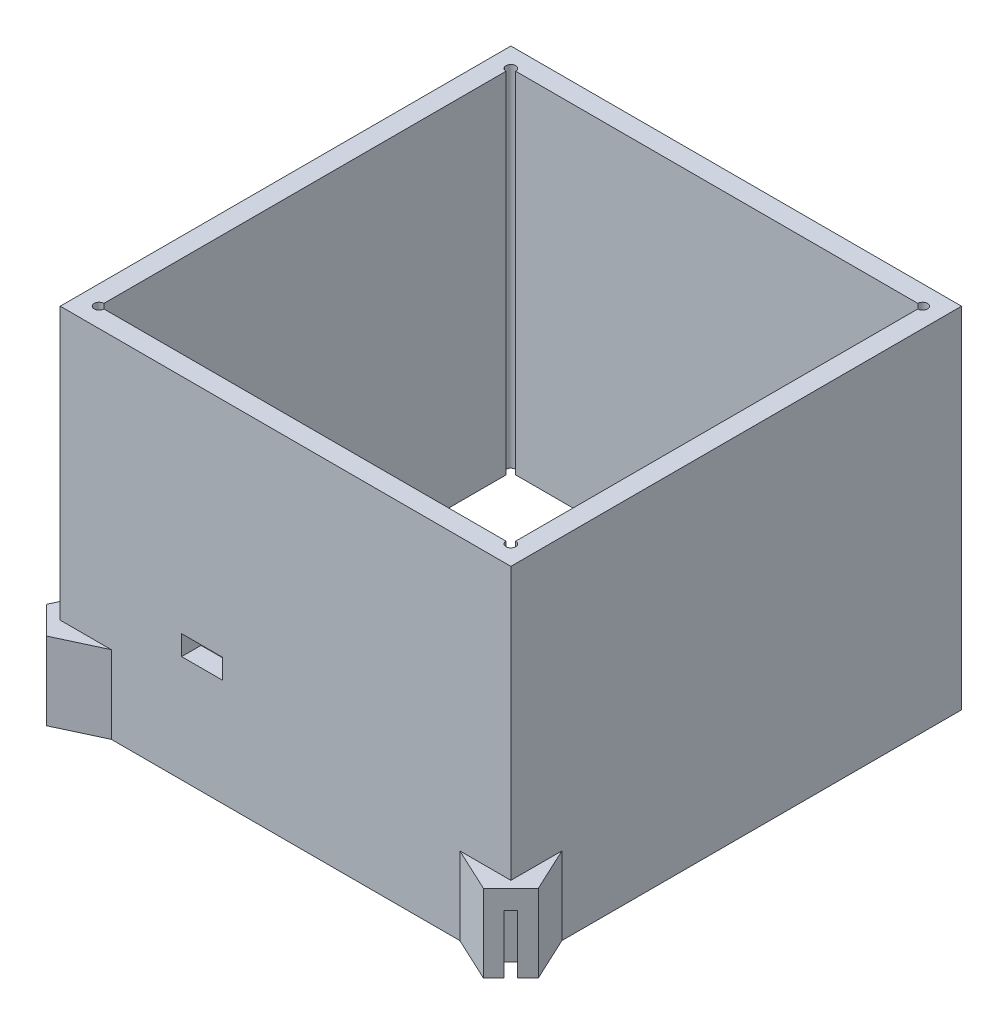
from build123d import *

# Parameters (mm, degrees)
SKETCH2_W           = 232
SKETCH2_H           = 232
SKETCH2_W_2         = 212
SKETCH2_H_2         = 212
BOSS_EXTRUDE1_DEPTH = 180
CUT_EXTRUDE1_REACH  = 317.721
SKETCH3_W           = 21
SKETCH3_H           = 10.25
CUT_EXTRUDE2_REACH  = 317.721
SKETCH4_W           = 21
SKETCH4_H           = 10.25
CUT_EXTRUDE3_REACH  = 245.541
SKETCH5_R           = 2.5
BOSS_EXTRUDE2_DEPTH = 40
BOSS_EXTRUDE3_DEPTH = 40
CUT_EXTRUDE4_DEPTH  = 30


with BuildPart() as part:
    # Sketch2 → Boss-Extrude1 (new body)
    with BuildSketch(Plane(origin=(0, 0, 0), x_dir=(1, 0, 0), z_dir=(0, 1, 0))):
        Rectangle(SKETCH2_W, SKETCH2_H)
        Rectangle(SKETCH2_W_2, SKETCH2_H_2, mode=Mode.SUBTRACT)
    extrude(amount=BOSS_EXTRUDE1_DEPTH)

    # Sketch3 → Cut-Extrude1 (cut, up to next)
    with BuildSketch(Plane.XY.offset(116), mode=Mode.PRIVATE) as cut_extrude1_sk1:
        with Locations((-43, 60.125)):
            Rectangle(SKETCH3_W, SKETCH3_H)
    cut_extrude1_tool1 = extrude(cut_extrude1_sk1.sketch, amount=-CUT_EXTRUDE1_REACH, mode=Mode.PRIVATE) & part.part
    add(cut_extrude1_tool1.solids().sort_by_distance((-43, 60.125, 116))[0], mode=Mode.SUBTRACT)

    # Sketch4 → Cut-Extrude2 (cut, up to next)
    with BuildSketch(Plane(origin=(0, 0, -116), x_dir=(-1, 0, 0), z_dir=(0, 0, -1)), mode=Mode.PRIVATE) as cut_extrude2_sk1:
        with Locations((-43, 60.125)):
            Rectangle(SKETCH4_W, SKETCH4_H)
    cut_extrude2_tool1 = extrude(cut_extrude2_sk1.sketch, amount=-CUT_EXTRUDE2_REACH, mode=Mode.PRIVATE) & part.part
    add(cut_extrude2_tool1.solids().sort_by_distance((43, 60.125, -116))[0], mode=Mode.SUBTRACT)

    # Sketch5 → Cut-Extrude3 (cut, up to next)
    with BuildSketch(Plane(origin=(0, 180, 0), x_dir=(1, 0, 0), z_dir=(0, 1, 0)), mode=Mode.PRIVATE) as cut_extrude3_sk1:
        with Locations((-106, 106)):
            Circle(SKETCH5_R)
    cut_extrude3_tool1 = extrude(cut_extrude3_sk1.sketch, amount=-CUT_EXTRUDE3_REACH, mode=Mode.PRIVATE) & part.part
    # Sketch5 → Cut-Extrude3 (cut, up to next)
    with BuildSketch(Plane(origin=(0, 180, 0), x_dir=(1, 0, 0), z_dir=(0, 1, 0)), mode=Mode.PRIVATE) as cut_extrude3_sk2:
        with Locations((106, 106)):
            Circle(SKETCH5_R)
    cut_extrude3_tool2 = extrude(cut_extrude3_sk2.sketch, amount=-CUT_EXTRUDE3_REACH, mode=Mode.PRIVATE) & part.part
    # Sketch5 → Cut-Extrude3 (cut, up to next)
    with BuildSketch(Plane(origin=(0, 180, 0), x_dir=(1, 0, 0), z_dir=(0, 1, 0)), mode=Mode.PRIVATE) as cut_extrude3_sk3:
        with Locations((106, -106)):
            Circle(SKETCH5_R)
    cut_extrude3_tool3 = extrude(cut_extrude3_sk3.sketch, amount=-CUT_EXTRUDE3_REACH, mode=Mode.PRIVATE) & part.part
    # Sketch5 → Cut-Extrude3 (cut, up to next)
    with BuildSketch(Plane(origin=(0, 180, 0), x_dir=(1, 0, 0), z_dir=(0, 1, 0)), mode=Mode.PRIVATE) as cut_extrude3_sk4:
        with Locations((-106, -106)):
            Circle(SKETCH5_R)
    cut_extrude3_tool4 = extrude(cut_extrude3_sk4.sketch, amount=-CUT_EXTRUDE3_REACH, mode=Mode.PRIVATE) & part.part
    add(cut_extrude3_tool1.solids().sort_by_distance((-106, 180, -106))[0], mode=Mode.SUBTRACT)
    add(cut_extrude3_tool2.solids().sort_by_distance((106, 180, -106))[0], mode=Mode.SUBTRACT)
    add(cut_extrude3_tool3.solids().sort_by_distance((106, 180, 106))[0], mode=Mode.SUBTRACT)
    add(cut_extrude3_tool4.solids().sort_by_distance((-106, 180, 106))[0], mode=Mode.SUBTRACT)

    # Sketch6 → Boss-Extrude2 (add)
    with BuildSketch(Plane(origin=(0, 0, 0), x_dir=(1, 0, 0), z_dir=(0, 1, 0))):
        Polygon((-116, -89.718535307), (-126.606601718, -112.464466094), (-112.464466094, -126.606601718), (-89.718535307, -116), (-116, -116), align=None)
        Polygon((116, -89.718535307), (116, -116), (89.718535307, -116), (112.464466094, -126.606601718), (126.606601718, -112.464466094), align=None)
    extrude(amount=BOSS_EXTRUDE2_DEPTH)

    # Sketch7 → Boss-Extrude3 (add)
    with BuildSketch(Plane(origin=(0, 0, 0), x_dir=(1, 0, 0), z_dir=(0, 1, 0))):
        Polygon((-10, 121), (10, 121), (20.722534603, 116), (-20.722534603, 116), align=None)
    extrude(amount=BOSS_EXTRUDE3_DEPTH)

    # Sketch8 → Cut-Extrude4 (cut)
    with BuildSketch(Plane.XZ):
        Polygon((-114.232233047, 117.767766953), (-117.767766953, 121.303300859), (-121.303300859, 117.767766953), (-117.767766953, 114.232233047), (-121.303300859, 110.696699141), (-117.767766953, 107.161165235), (-107.161165235, 117.767766953), (-110.696699141, 121.303300859), align=None)
        Polygon((117.767766953, 121.303300859), (114.232233047, 117.767766953), (110.696699141, 121.303300859), (107.161165235, 117.767766953), (117.767766953, 107.161165235), (121.303300859, 110.696699141), (117.767766953, 114.232233047), (121.303300859, 117.767766953), align=None)
        Polygon((0, -111), (0, -121), (2.5, -121), (2.5, -116), (7.5, -116), (7.5, -111), align=None)
        Polygon((-2.5, -121), (0, -121), (0, -111), (-7.5, -111), (-7.5, -116), (-2.5, -116), align=None)
    extrude(amount=-CUT_EXTRUDE4_DEPTH, mode=Mode.SUBTRACT)


solid = part.part
